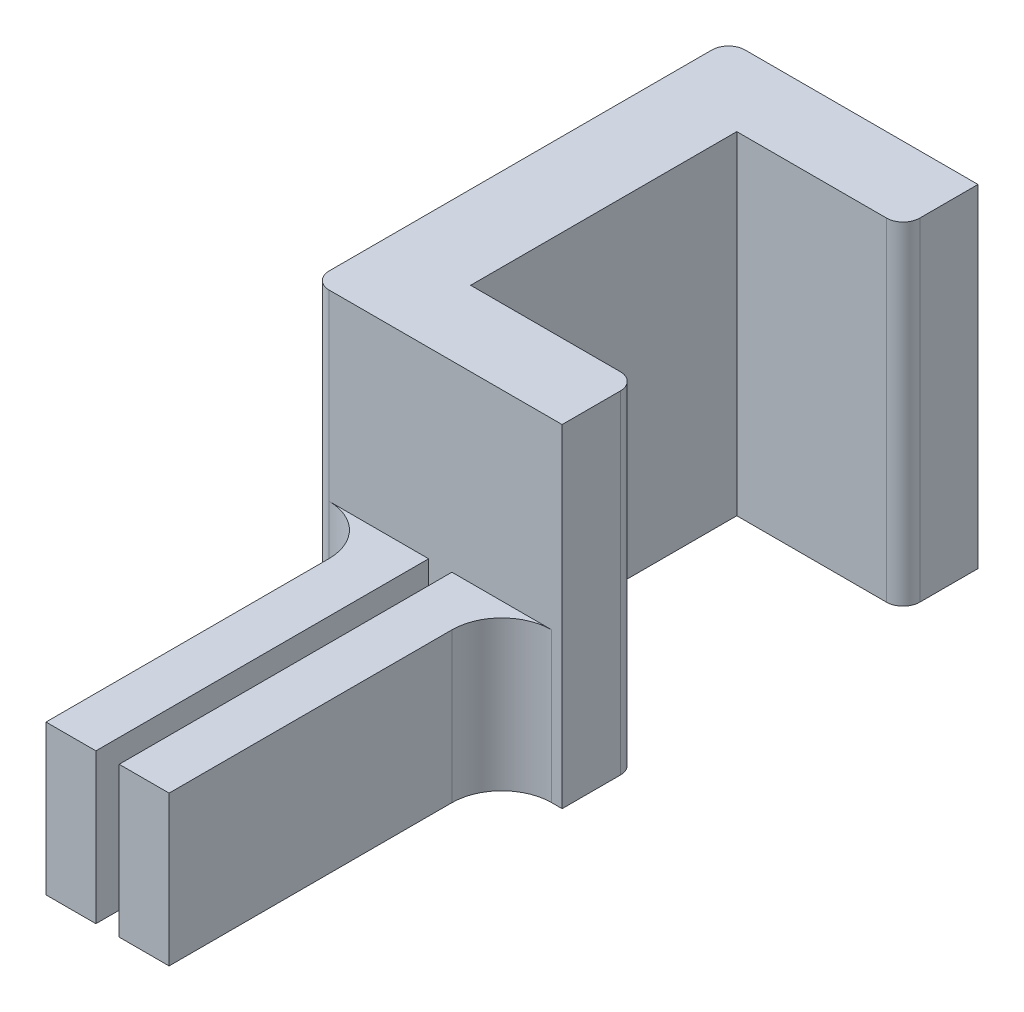
from build123d import *

# Parameters (mm, degrees)
BOSS_EXTRUDE1_DEPTH = 20
SKETCH2_W           = 3
SKETCH2_H           = 20
BOSS_EXTRUDE2_DEPTH = 9
FILLET1_R           = 3
FILLET2_R           = 1
FILLET3_R           = 1


with BuildPart() as part:
    # Sketch1 → Boss-Extrude1 (new body)
    with BuildSketch(Plane(origin=(0, 0, 0), x_dir=(1, 0, 0), z_dir=(0, 1, 0))):
        Polygon((0, 0), (0, 25), (15, 25), (15, 20.5), (5, 20.5), (5, 4.5), (15, 4.5), (15, 0), align=None)
    extrude(amount=BOSS_EXTRUDE1_DEPTH)

    # Sketch2 → Boss-Extrude2 (add)
    with BuildSketch(Plane(origin=(0, 0, 0), x_dir=(1, 0, 0), z_dir=(0, 1, 0))):
        with Locations((5.473944713, -10)):
            Rectangle(SKETCH2_W, SKETCH2_H)
        with Locations((9.873944713, -10)):
            Rectangle(SKETCH2_W, SKETCH2_H)
    extrude(amount=BOSS_EXTRUDE2_DEPTH)

    # Fillet1
    fillet1_edges = [part.edges().sort_by_distance(p)[0] for p in [
        (3.973944713, 4.5, 0),
        (11.373944713, 4.5, 0),
    ]]
    fillet(fillet1_edges, radius=FILLET1_R)

    # Fillet2
    fillet2_edges = [part.edges().sort_by_distance(p)[0] for p in [
        (15, 10, -20.5),
        (15, 10, -4.5),
    ]]
    fillet(fillet2_edges, radius=FILLET2_R)

    # Fillet3
    # the kernel refuses this fillet: 1 mm, written as the material it takes off along each edge
    with BuildSketch(Plane(origin=(0, -2.5, -25), x_dir=(1, 0, 0), z_dir=(0, 1, 0))) as fillet3_piece_1:
        with BuildLine():
            CenterArc((FILLET3_R, -FILLET3_R), FILLET3_R, 90, 90)
            Line((0, -FILLET3_R), (0, 0))
            Line((0, 0), (FILLET3_R, 0))
        make_face()
    extrude(amount=25, mode=Mode.SUBTRACT)
    with BuildSketch(Plane(origin=(0, -2.499787848, 0), x_dir=(0.9999999979479802, 0, 6.406277746226832e-05), z_dir=(0, 1, 0))) as fillet3_piece_2:
        with BuildLine():
            CenterArc((0.999935941, 0.9999792), FILLET3_R, 180.003670527, 89.626782871)
            Line((-6.4057e-05, 0.999915137), (-0.100064057, 0.999908731))
            Line((-0.100064057, 0.999908731), (-0.1, -6.406e-06))
            Line((-0.1, -6.406e-06), (6.406e-06, -0.1))
            ThreePointArc((6.406e-06, -0.1), (0.973951118, -0.099937606), (0.992841204, -0.09999792))
            Line((0.992841204, -0.09999792), (0.99348618, 0))
        make_face()
    extrude(amount=11.499787747, mode=Mode.SUBTRACT)
    with BuildSketch(Plane(origin=(0, 8.999999898, 0), x_dir=(1, 0, 0), z_dir=(0, 1, 0))) as fillet3_piece_3:
        with BuildLine():
            CenterArc((FILLET3_R, FILLET3_R), FILLET3_R, 180, 90)
            Line((0, FILLET3_R), (0, 0))
            Line((0, 0), (FILLET3_R, 0))
        make_face()
    extrude(amount=13.500000102, mode=Mode.SUBTRACT)


solid = part.part
